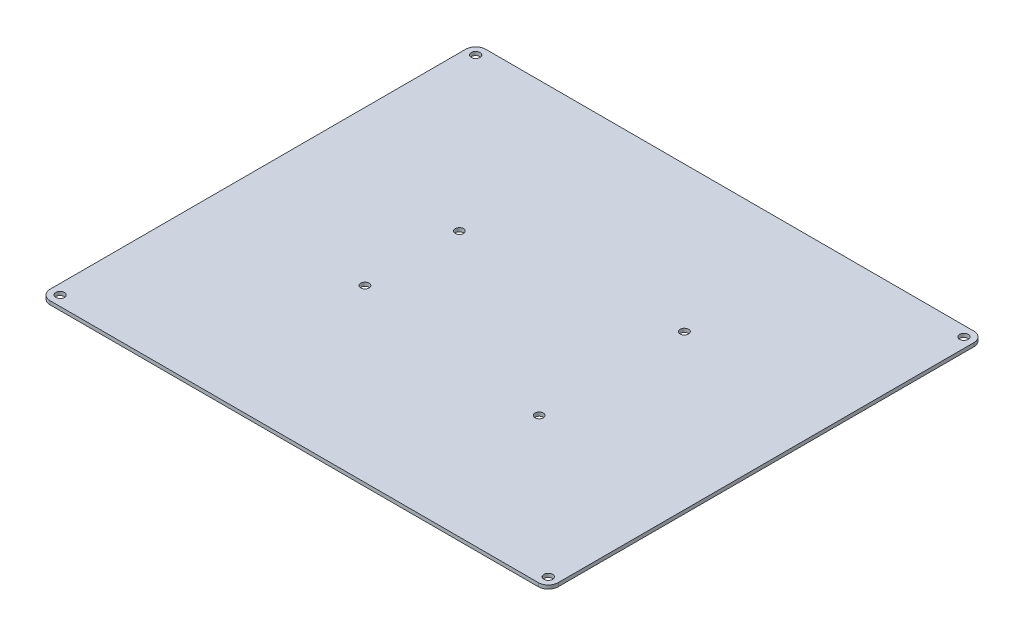
from build123d import *

# Parameters (mm, degrees)
SKETCH1_W           = 140
SKETCH1_H           = 120
SKETCH1_R           = 1.2
SKETCH1_R_2         = 1.15
BOSS_EXTRUDE1_DEPTH = 1
FILLET1_R           = 2.75


with BuildPart() as part:
    # Sketch1 → Boss-Extrude1 (new body)
    with BuildSketch(Plane(origin=(0, 0, 0), x_dir=(1, 0, 0), z_dir=(0, 1, 0))):
        with Locations((70, -60)):
            Rectangle(SKETCH1_W, SKETCH1_H)
        with Locations((2.75, -2.75)):
            Circle(SKETCH1_R, mode=Mode.SUBTRACT)
        with Locations((137.25, -2.75)):
            Circle(SKETCH1_R, mode=Mode.SUBTRACT)
        with Locations((137.25, -117.25)):
            Circle(SKETCH1_R, mode=Mode.SUBTRACT)
        with Locations((2.75, -117.25)):
            Circle(SKETCH1_R, mode=Mode.SUBTRACT)
        with Locations((42.5, -47)):
            Circle(SKETCH1_R_2, mode=Mode.SUBTRACT)
        with Locations((97.5, -40)):
            Circle(SKETCH1_R_2, mode=Mode.SUBTRACT)
        with Locations((42.5, -73)):
            Circle(SKETCH1_R_2, mode=Mode.SUBTRACT)
        with Locations((97.5, -80)):
            Circle(SKETCH1_R_2, mode=Mode.SUBTRACT)
    extrude(amount=BOSS_EXTRUDE1_DEPTH)

    # Fillet1
    fillet1_edges = [part.edges().sort_by_distance(p)[0] for p in [
        (0, 0.5, 0),
        (140, 0.5, 0),
        (140, 0.5, 120),
        (0, 0.5, 120),
    ]]
    fillet(fillet1_edges, radius=FILLET1_R)


solid = part.part
